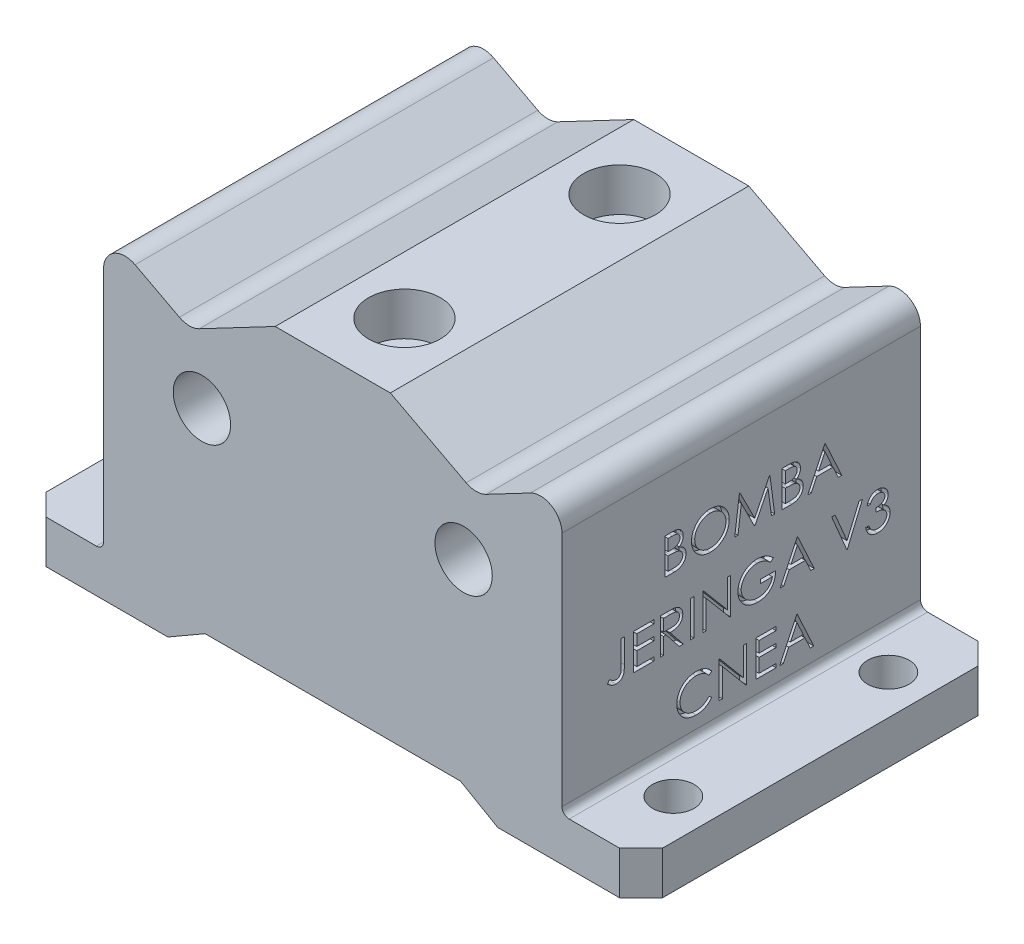
from build123d import *

# Parameters (mm, degrees)
SALIENTE_EXTRUIR1_DEPTH                              = 25
REDONDEO1_R                                          = 3
CHAFL_N1_SIZE                                        = 3
REDONDEO2_R                                          = 1
REDONDEO1_OF_SIMETR_A1_R                             = 3
CHAFL_N1_OF_SIMETR_A1_SIZE                           = 3
REDONDEO2_OF_SIMETR_A1_R                             = 1
TALADRO_DE_MARGEN_PARA_M51_D                         = 5.8
REFRENTADO_PARA_TORNILLO_CON_CABEZA_HUEC_D           = 4.8
REFRENTADO_PARA_TORNILLO_CON_CABEZA_HUEC_CBORE_D     = 8
REFRENTADO_PARA_TORNILLO_CON_CABEZA_HUEC_CBORE_DEPTH = 42
REFRENTADO_PARA_TORNILLO_CON_CABEZA_2_D              = 5.5
REFRENTADO_PARA_TORNILLO_CON_CABEZA_2_CBORE_D        = 10
REFRENTADO_PARA_TORNILLO_CON_CABEZA_2_CBORE_DEPTH    = 30
REFRENTADO_PARA_TORNILLO_CON_CABEZA_3_D              = 5.5
REFRENTADO_PARA_TORNILLO_CON_CABEZA_3_CBORE_D        = 10
REFRENTADO_PARA_TORNILLO_CON_CABEZA_3_CBORE_DEPTH    = 6
CROQUIS28_W                                          = 0.448717949
CROQUIS28_H                                          = 5
CORTAR_EXTRUIR1_DEPTH                                = 1
TALADRO1_D                                           = 4.1
TALADRO1_DEPTH                                       = 5


with BuildPart() as part:
    # Croquis2 → Saliente-Extruir1 (new, symmetric)
    with BuildSketch(Plane.XY):
        Polygon((-43, 6), (-43, 0), (-23, 0), (-17.803847577, 3), (0, 3), (0, 45), (-8.029229647, 45), (-20, 38.699473768), (-31.970770353, 45), (-31.970770353, 6), align=None)
    saliente_extruir1 = extrude(amount=SALIENTE_EXTRUIR1_DEPTH, both=True)

    # Croquis21 → Diámetro de taladro Ø8.6 (8.6)1 (revolve, cut)
    with BuildSketch(Plane(origin=(-22, 20, -25), x_dir=(0, 1, 0), z_dir=(1, 0, 0))):
        Polygon((0, 0), (0, 16.3), (4.3, 12), (4.3, 0), align=None)
    di_metro_de_taladro_8_6_8_6_1 = revolve(axis=Axis((-22, 20, -31.35), (0, 0, 1)), mode=Mode.SUBTRACT)

    # Redondeo1
    redondeo1_edges = [part.edges().sort_by_distance(p)[0] for p in [
        (-20, 38.699473768, 0),
        (-31.970770353, 45, 0),
    ]]
    fillet(redondeo1_edges, radius=REDONDEO1_R)

    # Chaflán1
    chafl_n1_edges = [part.edges().sort_by_distance(p)[0] for p in [
        (-43, 3, -25),
        (-43, 3, 25),
    ]]
    chamfer(chafl_n1_edges, length=CHAFL_N1_SIZE)

    # Redondeo2
    redondeo2_edges = [part.edges().sort_by_distance(p)[0] for p in [
        (-31.970770353, 6, 0),
    ]]
    fillet(redondeo2_edges, radius=REDONDEO2_R)

    # Simetría1: Saliente-Extruir1, Diámetro de taladro Ø8.6 (8.6)1 across plane
    add(saliente_extruir1.mirror(Plane(origin=(0, 0, 0), x_dir=(0, 0, 1), z_dir=(1, 0, 0))))
    add(di_metro_de_taladro_8_6_8_6_1.mirror(Plane(origin=(0, 0, 0), x_dir=(0, 0, 1), z_dir=(1, 0, 0))), mode=Mode.SUBTRACT)

    # Redondeo1 of Simetría1
    redondeo1_of_simetr_a1_edges = [part.edges().sort_by_distance(p)[0] for p in [
        (20, 38.699473768, 0),
        (31.970770353, 45, 0),
    ]]
    fillet(redondeo1_of_simetr_a1_edges, radius=REDONDEO1_OF_SIMETR_A1_R)

    # Chaflán1 of Simetría1
    chafl_n1_of_simetr_a1_edges = [part.edges().sort_by_distance(p)[0] for p in [
        (43, 3, -25),
        (43, 3, 25),
    ]]
    chamfer(chafl_n1_of_simetr_a1_edges, length=CHAFL_N1_OF_SIMETR_A1_SIZE)

    # Redondeo2 of Simetría1
    redondeo2_of_simetr_a1_edges = [part.edges().sort_by_distance(p)[0] for p in [
        (31.970770353, 6, 0),
    ]]
    fillet(redondeo2_of_simetr_a1_edges, radius=REDONDEO2_OF_SIMETR_A1_R)

    # Taladro de margen para M51 (through all)
    with Locations(Plane(origin=(0, 45, 0), x_dir=(-1, 0, 0), z_dir=(0, 1, 0))):
        with Locations((37.5, -15)):
            taladro_de_margen_para_m51 = Hole(TALADRO_DE_MARGEN_PARA_M51_D / 2)

    # Matriz de croquis1: Taladro de margen para M51 at 3 more places
    with Locations((75, 0, 30), (75, 0, 0), (0, 0, 30)):
        add(taladro_de_margen_para_m51, mode=Mode.SUBTRACT)

    # Refrentado para tornillo con cabeza huec (through all)
    with Locations(Plane(origin=(0, 0, 25), x_dir=(-1, 0, 0), z_dir=(0, 0, 1))):
        with Locations((-18.25, -30), (18.25, -30)):
            CounterBoreHole(REFRENTADO_PARA_TORNILLO_CON_CABEZA_HUEC_D / 2, REFRENTADO_PARA_TORNILLO_CON_CABEZA_HUEC_CBORE_D / 2, REFRENTADO_PARA_TORNILLO_CON_CABEZA_HUEC_CBORE_DEPTH)

    # Refrentado para tornillo con cabeza  2 (through all)
    with Locations(Plane(origin=(0, 3, 0), x_dir=(-1, 0, 0), z_dir=(0, -1, 0))):
        with Locations((0, 15), (0, -15)):
            CounterBoreHole(REFRENTADO_PARA_TORNILLO_CON_CABEZA_2_D / 2, REFRENTADO_PARA_TORNILLO_CON_CABEZA_2_CBORE_D / 2, REFRENTADO_PARA_TORNILLO_CON_CABEZA_2_CBORE_DEPTH)

    # Refrentado para tornillo con cabeza  3 (through all)
    with Locations(Plane(origin=(0, 45, 0), x_dir=(1, 0, 0), z_dir=(0, 1, 0))):
        with Locations((0, 15), (0, -15)):
            CounterBoreHole(REFRENTADO_PARA_TORNILLO_CON_CABEZA_3_D / 2, REFRENTADO_PARA_TORNILLO_CON_CABEZA_3_CBORE_D / 2, REFRENTADO_PARA_TORNILLO_CON_CABEZA_3_CBORE_DEPTH)

    # Croquis28 → Cortar-Extruir1 (cut)
    # profile 1 of 18: a face of its own
    with BuildSketch(Plane(origin=(31.970770353, 0, 0), x_dir=(0, 0, -1), z_dir=(1, 0, 0))):
        with BuildLine():
            Line((-10.649410219, 32.506300776), (-9.673849322, 32.506300776))
            add(Edge.make_bspline(
                [(-9.673849322, 32.506300776), (-9.626094353, 32.506049704), (-9.533533338, 32.505563064), (-9.398934135, 32.498015734), (-9.272864406, 32.487724777), (-9.155287588, 32.471396073), (-9.046258013, 32.451693534), (-8.945447103, 32.427833797), (-8.853175428, 32.399224349), (-8.743014376, 32.353729662), (-8.617413432, 32.286125135), (-8.481415728, 32.186227185), (-8.365123958, 32.064037952), (-8.26485779, 31.926205587), (-8.185141905, 31.774583056), (-8.12747148, 31.612784215), (-8.09096023, 31.442896012), (-8.087205324, 31.326262901), (-8.085307655, 31.267318404)],
                knots=[0, 0, 0, 0, 1.001505555, 1.941167018, 2.826882275, 3.653841531, 4.429895133, 5.150066043, 5.825578002, 6.45369114, 7.647487171, 8.808567382, 9.977351308, 11.170798116, 12.373658725, 13.556498008, 14.765093433, 16, 16, 16, 16], degree=3))
            add(Edge.make_bspline(
                [(-8.085307655, 31.267318404), (-8.086869395, 31.212100468), (-8.089938363, 31.103592015), (-8.119285162, 30.944886144), (-8.165228974, 30.793812975), (-8.229093616, 30.650923853), (-8.312096468, 30.519447262), (-8.410465494, 30.398322597), (-8.529146641, 30.292678229), (-8.618065555, 30.23361694), (-8.663232334, 30.203616481)],
                knots=[0, 0, 0, 0, 1.044552857, 2.05264487, 3.044412934, 4.028983338, 5.005914585, 5.980388656, 6.974128949, 8, 8, 8, 8], degree=3))
            add(Edge.make_bspline(
                [(-8.663232334, 30.203616481), (-8.606431723, 30.18180934), (-8.497758084, 30.140086876), (-8.348206638, 30.066321928), (-8.219356859, 29.986090342), (-8.110218079, 29.898473413), (-8.016878572, 29.804032255), (-7.93537437, 29.701382091), (-7.86582955, 29.589183866), (-7.806239659, 29.468607387), (-7.759741436, 29.340883861), (-7.724918716, 29.207211323), (-7.704965217, 29.068069102), (-7.702125729, 28.973375702), (-7.70069227, 28.925571609)],
                knots=[0, 0, 0, 0, 1.27268992, 2.434971085, 3.483601985, 4.442670788, 5.356604649, 6.2567628, 7.179492994, 8.113709626, 9.066344395, 10.018646069, 10.999752585, 12, 12, 12, 12], degree=3))
            add(Edge.make_bspline(
                [(-7.70069227, 28.925571609), (-7.702087765, 28.876761792), (-7.704833439, 28.780727109), (-7.725090541, 28.639648345), (-7.759389266, 28.504826993), (-7.80663376, 28.375391018), (-7.86829421, 28.251590826), (-7.943334159, 28.133286163), (-8.032807821, 28.021665691), (-8.132897634, 27.915489086), (-8.24612927, 27.820020819), (-8.368294635, 27.73499838), (-8.500932234, 27.665075435), (-8.641863654, 27.606338261), (-8.79266982, 27.561470835), (-8.952673545, 27.530081443), (-9.121736833, 27.50893139), (-9.237750764, 27.507192526), (-9.297246757, 27.506300776)],
                knots=[0, 0, 0, 0, 0.978564426, 1.925352924, 2.850884081, 3.763762016, 4.682927383, 5.618979971, 6.567305752, 7.547517671, 8.540179244, 9.531824382, 10.526200242, 11.540722885, 12.589160233, 13.674978461, 14.80764778, 16, 16, 16, 16], degree=3))
            Line((-9.297246757, 27.506300776), (-10.649410219, 27.506300776))
            Line((-10.649410219, 27.506300776), (-10.649410219, 32.506300776))
        make_face()
        with BuildLine():
            Line((-10.20069227, 31.993480263), (-10.20069227, 30.390916161))
            Line((-10.20069227, 30.390916161), (-9.899209898, 30.390916161))
            add(Edge.make_bspline(
                [(-9.899209898, 30.390916161), (-9.855140191, 30.391487479), (-9.769988535, 30.392591383), (-9.646674397, 30.39575355), (-9.532210085, 30.404607898), (-9.426793181, 30.413459701), (-9.330589689, 30.427851969), (-9.243812744, 30.444983573), (-9.165100463, 30.463102009), (-9.074329684, 30.493915562), (-8.971368329, 30.539455098), (-8.861606751, 30.61012915), (-8.764843223, 30.694306797), (-8.683132955, 30.791436742), (-8.616259426, 30.898388436), (-8.569811261, 31.013455408), (-8.538315141, 31.133769883), (-8.535470096, 31.216367387), (-8.534025604, 31.258303981)],
                knots=[0, 0, 0, 0, 1.156816544, 2.235205308, 3.236616184, 4.169592532, 5.011045266, 5.787822928, 6.49130361, 7.128639758, 8.301311294, 9.436451833, 10.541879658, 11.654887649, 12.756523258, 13.837046038, 14.901820046, 16, 16, 16, 16], degree=3))
            add(Edge.make_bspline(
                [(-8.534025604, 31.258303981), (-8.53477729, 31.286055083), (-8.536251804, 31.340491901), (-8.54832795, 31.419848121), (-8.568853057, 31.494482053), (-8.595216333, 31.565416496), (-8.632057317, 31.630433425), (-8.675433693, 31.691780848), (-8.727841822, 31.747369588), (-8.787495125, 31.799326015), (-8.856078872, 31.845389626), (-8.933552146, 31.885733573), (-9.020963114, 31.918220397), (-9.116838621, 31.946672043), (-9.22265446, 31.96665532), (-9.337189536, 31.983303017), (-9.461381992, 31.991778363), (-9.547303567, 31.99290031), (-9.591717911, 31.993480263)],
                knots=[0, 0, 0, 0, 0.91205012, 1.789085906, 2.630437955, 3.453916878, 4.269457761, 5.079663411, 5.91843418, 6.774407191, 7.675494373, 8.627863946, 9.638891023, 10.736472738, 11.911756761, 13.175263542, 14.539845004, 16, 16, 16, 16], degree=3))
            Line((-9.591717911, 31.993480263), (-10.20069227, 31.993480263))
        make_face(mode=Mode.SUBTRACT)
        with BuildLine():
            Line((-10.20069227, 29.878095648), (-10.20069227, 28.019121289))
            Line((-10.20069227, 28.019121289), (-9.561669834, 28.019121289))
            add(Edge.make_bspline(
                [(-9.561669834, 28.019121289), (-9.515928512, 28.0196695), (-9.427768142, 28.020726103), (-9.300480671, 28.024175467), (-9.182504808, 28.032021575), (-9.0743789, 28.044372789), (-8.974935396, 28.057770573), (-8.885367249, 28.075786689), (-8.804948401, 28.096428061), (-8.71169939, 28.128334021), (-8.606694378, 28.177900408), (-8.493536012, 28.252635018), (-8.392927129, 28.341668314), (-8.307491044, 28.444712477), (-8.237472489, 28.55675723), (-8.186536125, 28.675536302), (-8.155120615, 28.799087055), (-8.151317516, 28.883325216), (-8.149410219, 28.925571609)],
                knots=[0, 0, 0, 0, 1.160039823, 2.235823828, 3.228722157, 4.157150951, 4.99529583, 5.772374946, 6.472645482, 7.099169577, 8.269452708, 9.405989375, 10.527446681, 11.663510218, 12.788923519, 13.866172445, 14.929861265, 16, 16, 16, 16], degree=3))
            add(Edge.make_bspline(
                [(-8.149410219, 28.925571609), (-8.149804654, 28.951990667), (-8.150587161, 29.004402641), (-8.162388039, 29.08142524), (-8.179550711, 29.156033631), (-8.201738473, 29.228430403), (-8.234051998, 29.297306655), (-8.271775633, 29.364024597), (-8.316006207, 29.428672425), (-8.384926444, 29.510404215), (-8.485172136, 29.604571377), (-8.627610387, 29.696767808), (-8.789570813, 29.771121818), (-8.90703866, 29.802692499), (-8.967719514, 29.819001097)],
                knots=[0, 0, 0, 0, 0.723448775, 1.435228256, 2.130040452, 2.821711965, 3.505591119, 4.210454504, 4.921174351, 5.648778258, 7.137944449, 8.670945889, 10.280296675, 12, 12, 12, 12], degree=3))
            add(Edge.make_bspline(
                [(-8.967719514, 29.819001097), (-8.992046794, 29.823936931), (-9.044793354, 29.834638838), (-9.130804183, 29.845935557), (-9.228998282, 29.855999928), (-9.339602392, 29.863444439), (-9.462756451, 29.871139501), (-9.598723477, 29.874132103), (-9.746948213, 29.877702474), (-9.849794459, 29.877961237), (-9.903216309, 29.878095648)],
                knots=[0, 0, 0, 0, 0.634451884, 1.375622551, 2.216452059, 3.157844607, 4.20941857, 5.370758133, 6.634282058, 8, 8, 8, 8], degree=3))
            Line((-9.903216309, 29.878095648), (-10.20069227, 29.878095648))
        make_face(mode=Mode.SUBTRACT)
    # profile 2 of 18: a face of its own
    with BuildSketch(Plane(origin=(31.970770353, 0, 0), x_dir=(0, 0, -1), z_dir=(1, 0, 0))):
        with BuildLine():
            add(Edge.make_bspline(
                [(-4.335307655, 32.634505904), (-4.242724646, 32.632160934), (-4.060883979, 32.627555218), (-3.793634125, 32.592299356), (-3.538498275, 32.531305942), (-3.293398077, 32.45007311), (-3.061265253, 32.341709702), (-2.84035255, 32.210730919), (-2.631185587, 32.055764549), (-2.436583613, 31.878008511), (-2.258502256, 31.684603576), (-2.101608133, 31.478206562), (-1.970119141, 31.260065416), (-1.862139446, 31.030835658), (-1.777427146, 30.791035704), (-1.718971369, 30.539387128), (-1.681631155, 30.277520428), (-1.677265758, 30.098910621), (-1.675051245, 30.008303981)],
                knots=[0, 0, 0, 0, 1.065120563, 2.091984664, 3.0946048, 4.079830382, 5.057816894, 6.036188127, 7.030412546, 8.04752943, 9.064399622, 10.05169764, 11.02544977, 11.989514704, 12.962713494, 13.945757189, 14.957906945, 16, 16, 16, 16], degree=3))
            add(Edge.make_bspline(
                [(-1.675051245, 30.008303981), (-1.677265434, 29.918364772), (-1.681629858, 29.741084172), (-1.719013825, 29.480879251), (-1.777643825, 29.230749685), (-1.861352777, 28.991113038), (-1.968817746, 28.761716518), (-2.101182277, 28.543163727), (-2.257098292, 28.335383015), (-2.434536651, 28.140650636), (-2.627966711, 27.962082821), (-2.83543852, 27.806484427), (-3.05228612, 27.672592821), (-3.281299989, 27.565759001), (-3.519442899, 27.480370543), (-3.768846217, 27.4221525), (-4.028341295, 27.384599581), (-4.205299871, 27.380287415), (-4.295243552, 27.378095648)],
                knots=[0, 0, 0, 0, 1.043624062, 2.057103931, 3.04512605, 4.022047818, 4.998200453, 5.980619268, 6.982898556, 8.009068085, 9.034988726, 10.034168286, 11.015286542, 11.987931943, 12.962482838, 13.94673481, 14.956375938, 16, 16, 16, 16], degree=3))
            add(Edge.make_bspline(
                [(-4.295243552, 27.378095648), (-4.385849722, 27.380309058), (-4.564458602, 27.384672278), (-4.826654367, 27.422074284), (-5.078479715, 27.480561861), (-5.319214503, 27.56414677), (-5.548992974, 27.672171386), (-5.76826452, 27.803891927), (-5.976149016, 27.960187843), (-6.17092294, 28.137568664), (-6.34913608, 28.330670881), (-6.504506617, 28.53757696), (-6.636256779, 28.754227612), (-6.743918682, 28.981224075), (-6.829153624, 29.217468993), (-6.887303364, 29.464538247), (-6.924926153, 29.721023255), (-6.929261648, 29.895655967), (-6.931461501, 29.98426552)],
                knots=[0, 0, 0, 0, 1.053102029, 2.075944431, 3.073151272, 4.055350789, 5.033113405, 6.020478099, 7.024410459, 8.052272461, 9.079885166, 10.07527673, 11.055994387, 12.023226415, 12.992069828, 13.970394897, 14.97016774, 16, 16, 16, 16], degree=3))
            add(Edge.make_bspline(
                [(-6.931461501, 29.98426552), (-6.930697736, 30.043740761), (-6.929179841, 30.161940938), (-6.910905995, 30.337464652), (-6.884389279, 30.510165592), (-6.846386547, 30.67955266), (-6.796684165, 30.84521121), (-6.738038412, 31.008283728), (-6.666410061, 31.167117619), (-6.585437707, 31.322465322), (-6.495063695, 31.471905187), (-6.395241196, 31.613161735), (-6.289476384, 31.747420302), (-6.173528679, 31.871201736), (-6.051219472, 31.988106959), (-5.920564646, 32.096339412), (-5.782361439, 32.196875056), (-5.636015183, 32.287475543), (-5.485131933, 32.369417164), (-5.329593679, 32.439734094), (-5.171512862, 32.500085611), (-5.01014908, 32.549001075), (-4.845930834, 32.58761827), (-4.678499713, 32.613914489), (-4.507989104, 32.632234943), (-4.393115791, 32.63374566), (-4.335307655, 32.634505904)],
                knots=[0, 0, 0, 0, 1.037015668, 2.060948919, 3.074880161, 4.083647147, 5.086022904, 6.090072063, 7.104153813, 8.122640571, 9.144368836, 10.147691507, 11.138137339, 12.123020368, 13.103399296, 14.087645067, 15.080126199, 16.082011238, 17.087798457, 18.072939717, 19.057185487, 20.037253025, 21.01195951, 21.997135196, 22.992090687, 24, 24, 24, 24], degree=3))
        make_face()
        with BuildLine():
            add(Edge.make_bspline(
                [(-4.313272398, 32.121685392), (-4.360721875, 32.121106977), (-4.455167208, 32.119955677), (-4.595573688, 32.104790369), (-4.734133594, 32.083176242), (-4.870875539, 32.052345498), (-5.005227381, 32.010339709), (-5.13844144, 31.961995554), (-5.269302946, 31.903108282), (-5.397379886, 31.836575847), (-5.521544279, 31.762934531), (-5.638705281, 31.681546293), (-5.749166201, 31.594319787), (-5.852656582, 31.501051448), (-5.948872542, 31.401266302), (-6.03970783, 31.296477108), (-6.121521518, 31.183688692), (-6.196500913, 31.065959539), (-6.263597828, 30.943442995), (-6.32326262, 30.817428906), (-6.372068347, 30.686889353), (-6.411871742, 30.553240557), (-6.444871472, 30.416694186), (-6.465777078, 30.276214402), (-6.48110902, 30.132507099), (-6.482194513, 30.035390164), (-6.482743552, 29.986268725)],
                knots=[0, 0, 0, 0, 1.008559885, 2.007477868, 2.99961109, 3.989939068, 4.984837346, 5.991145699, 7.001802488, 8.033829008, 9.059044045, 10.069351652, 11.065060232, 12.050310815, 13.029377138, 14.011219647, 14.996725999, 15.989392538, 16.977580475, 17.965360261, 18.951710183, 19.937753436, 20.929683414, 21.935841486, 22.955955122, 24, 24, 24, 24], degree=3))
            add(Edge.make_bspline(
                [(-6.482743552, 29.986268725), (-6.480922321, 29.914036981), (-6.477339395, 29.771934795), (-6.445971438, 29.563694589), (-6.397654332, 29.363568466), (-6.326429523, 29.172651453), (-6.237357216, 28.989302477), (-6.127318801, 28.815148042), (-5.996948679, 28.650141078), (-5.848857927, 28.495433551), (-5.686968346, 28.35422526), (-5.515064446, 28.230277533), (-5.334987864, 28.125405747), (-5.146269003, 28.03996993), (-4.949915376, 27.972270304), (-4.744661731, 27.92587226), (-4.53187536, 27.895335895), (-4.386831567, 27.892403387), (-4.313272398, 27.890916161)],
                knots=[0, 0, 0, 0, 1.032063989, 2.030389145, 3.003944642, 3.970395727, 4.937377036, 5.913328081, 6.909231446, 7.93887556, 8.970685674, 9.976071282, 10.964166581, 11.944589148, 12.933237628, 13.927779006, 14.949070134, 16, 16, 16, 16], degree=3))
            add(Edge.make_bspline(
                [(-4.313272398, 27.890916161), (-4.263830253, 27.891595453), (-4.16577163, 27.892942693), (-4.019920884, 27.906512231), (-3.876697724, 27.928272044), (-3.736303039, 27.959601552), (-3.598896165, 27.998811847), (-3.463903589, 28.045394316), (-3.332763174, 28.103510321), (-3.203820549, 28.167721681), (-3.080397347, 28.240921906), (-2.962575158, 28.319547834), (-2.853323758, 28.406645863), (-2.749910799, 28.498528453), (-2.653299814, 28.597048235), (-2.564144123, 28.702077124), (-2.482743934, 28.814278062), (-2.40779301, 28.931828642), (-2.340931206, 29.054680432), (-2.28267535, 29.1811514), (-2.233252328, 29.310930128), (-2.193354464, 29.444203801), (-2.162089518, 29.5807193), (-2.140546776, 29.720659411), (-2.125477578, 29.863744186), (-2.124341753, 29.960521123), (-2.123769193, 30.009305584)],
                knots=[0, 0, 0, 0, 1.047197238, 2.076906641, 3.100256066, 4.114471768, 5.12198147, 6.126382909, 7.136867548, 8.15857795, 9.17633901, 10.174870724, 11.156907918, 12.133735059, 13.104061851, 14.077631395, 15.04955518, 16.038496417, 17.029181396, 18.010275684, 18.986308667, 19.968651475, 20.955262928, 21.950658345, 22.966943676, 24, 24, 24, 24], degree=3))
            add(Edge.make_bspline(
                [(-2.123769193, 30.009305584), (-2.124342212, 30.057756304), (-2.1254789, 30.153867233), (-2.140539578, 30.295954116), (-2.162112278, 30.434887276), (-2.193201861, 30.57012128), (-2.233273509, 30.701690601), (-2.282683981, 30.82947167), (-2.340948695, 30.95394052), (-2.407817587, 31.074789515), (-2.482983049, 31.190753427), (-2.565117682, 31.301614016), (-2.655639608, 31.405289361), (-2.751962501, 31.504338924), (-2.856492337, 31.596650195), (-2.968755614, 31.682253796), (-3.08738944, 31.763215616), (-3.212999776, 31.836252133), (-3.342633996, 31.903701037), (-3.475653936, 31.961488184), (-3.610552649, 32.010591212), (-3.746987095, 32.05247259), (-3.886105636, 32.083055491), (-4.026968249, 32.104809848), (-4.169380047, 32.119950399), (-4.265156075, 32.121105225), (-4.313272398, 32.121685392)],
                knots=[0, 0, 0, 0, 1.02996197, 2.043119294, 3.035359645, 4.018872909, 4.991431989, 5.957985074, 6.929999688, 7.912076566, 8.892894881, 9.867085534, 10.843653904, 11.817741046, 12.803660682, 13.806313499, 14.818574707, 15.856120519, 16.894564902, 17.924820532, 18.937903209, 19.946497019, 20.957711757, 21.963978472, 22.977135795, 24, 24, 24, 24], degree=3))
        make_face(mode=Mode.SUBTRACT)
    # profile 3 of 18: a face of its own
    with BuildSketch(Plane(origin=(31.970770353, 0, 0), x_dir=(0, 0, -1), z_dir=(1, 0, 0))):
        Polygon((-0.905820475, 27.506300776), (-0.245764386, 32.506300776), (-0.181661822, 32.506300776), (1.882641063, 28.403736674), (3.941935935, 32.506300776), (4.007040102, 32.506300776), (4.671102602, 27.506300776), (4.220381448, 27.506300776), (3.741615422, 31.104057186), (1.936727602, 27.506300776), (1.835565743, 27.506300776), (0.023666704, 31.112070007), (-0.454097719, 27.506300776), align=None)
    # profile 4 of 18: a face of its own
    with BuildSketch(Plane(origin=(31.970770353, 0, 0), x_dir=(0, 0, -1), z_dir=(1, 0, 0))):
        with BuildLine():
            Line((5.696743627, 32.506300776), (6.672304525, 32.506300776))
            add(Edge.make_bspline(
                [(6.672304525, 32.506300776), (6.720059493, 32.506049704), (6.812620508, 32.505563064), (6.947219711, 32.498015734), (7.07328944, 32.487724777), (7.190866258, 32.471396073), (7.299895833, 32.451693534), (7.400706743, 32.427833797), (7.492978418, 32.399224349), (7.60313947, 32.353729662), (7.728740414, 32.286125135), (7.864738118, 32.186227185), (7.981029888, 32.064037952), (8.081296056, 31.926205587), (8.161011941, 31.774583056), (8.218682366, 31.612784215), (8.255193616, 31.442896012), (8.258948522, 31.326262901), (8.260846191, 31.267318404)],
                knots=[0, 0, 0, 0, 1.001505555, 1.941167018, 2.826882275, 3.653841531, 4.429895133, 5.150066043, 5.825578002, 6.45369114, 7.647487171, 8.808567382, 9.977351308, 11.170798116, 12.373658725, 13.556498008, 14.765093433, 16, 16, 16, 16], degree=3))
            add(Edge.make_bspline(
                [(8.260846191, 31.267318404), (8.259284451, 31.212100468), (8.256215483, 31.103592015), (8.226868684, 30.944886144), (8.180924872, 30.793812975), (8.11706023, 30.650923853), (8.034057379, 30.519447262), (7.935688352, 30.398322597), (7.817007205, 30.292678229), (7.728088291, 30.23361694), (7.682921512, 30.203616481)],
                knots=[0, 0, 0, 0, 1.044552857, 2.05264487, 3.044412934, 4.028983338, 5.005914585, 5.980388656, 6.974128949, 8, 8, 8, 8], degree=3))
            add(Edge.make_bspline(
                [(7.682921512, 30.203616481), (7.739722123, 30.18180934), (7.848395762, 30.140086876), (7.997947208, 30.066321928), (8.126796987, 29.986090342), (8.235935767, 29.898473413), (8.329275274, 29.804032255), (8.410779476, 29.701382091), (8.480324296, 29.589183866), (8.539914187, 29.468607387), (8.58641241, 29.340883861), (8.62123513, 29.207211323), (8.641188629, 29.068069102), (8.644028117, 28.973375702), (8.645461576, 28.925571609)],
                knots=[0, 0, 0, 0, 1.27268992, 2.434971085, 3.483601985, 4.442670788, 5.356604649, 6.2567628, 7.179492994, 8.113709626, 9.066344395, 10.018646069, 10.999752585, 12, 12, 12, 12], degree=3))
            add(Edge.make_bspline(
                [(8.645461576, 28.925571609), (8.644066082, 28.876761792), (8.641320407, 28.780727109), (8.621063305, 28.639648345), (8.586764581, 28.504826993), (8.539520086, 28.375391018), (8.477859636, 28.251590826), (8.402819687, 28.133286163), (8.313346025, 28.021665691), (8.213256212, 27.915489086), (8.100024576, 27.820020819), (7.977859212, 27.73499838), (7.845221612, 27.665075435), (7.704290192, 27.606338261), (7.553484026, 27.561470835), (7.393480301, 27.530081443), (7.224417013, 27.50893139), (7.108403083, 27.507192526), (7.048907089, 27.506300776)],
                knots=[0, 0, 0, 0, 0.978564426, 1.925352924, 2.850884081, 3.763762016, 4.682927383, 5.618979971, 6.567305752, 7.547517671, 8.540179244, 9.531824382, 10.526200242, 11.540722885, 12.589160233, 13.674978461, 14.80764778, 16, 16, 16, 16], degree=3))
            Line((7.048907089, 27.506300776), (5.696743627, 27.506300776))
            Line((5.696743627, 27.506300776), (5.696743627, 32.506300776))
        make_face()
        with BuildLine():
            Line((6.145461576, 31.993480263), (6.145461576, 30.390916161))
            Line((6.145461576, 30.390916161), (6.446943948, 30.390916161))
            add(Edge.make_bspline(
                [(6.446943948, 30.390916161), (6.491013655, 30.391487479), (6.576165311, 30.392591383), (6.699479449, 30.39575355), (6.813943761, 30.404607898), (6.919360665, 30.413459701), (7.015564157, 30.427851969), (7.102341102, 30.444983573), (7.181053383, 30.463102009), (7.271824163, 30.493915562), (7.374785518, 30.539455098), (7.484547095, 30.61012915), (7.581310623, 30.694306797), (7.663020891, 30.791436742), (7.72989442, 30.898388436), (7.776342585, 31.013455408), (7.807838705, 31.133769883), (7.81068375, 31.216367387), (7.812128243, 31.258303981)],
                knots=[0, 0, 0, 0, 1.156816544, 2.235205308, 3.236616184, 4.169592532, 5.011045266, 5.787822928, 6.49130361, 7.128639758, 8.301311294, 9.436451833, 10.541879658, 11.654887649, 12.756523258, 13.837046038, 14.901820046, 16, 16, 16, 16], degree=3))
            add(Edge.make_bspline(
                [(7.812128243, 31.258303981), (7.811376557, 31.286055083), (7.809902042, 31.340491901), (7.797825896, 31.419848121), (7.77730079, 31.494482053), (7.750937514, 31.565416496), (7.71409653, 31.630433425), (7.670720153, 31.691780848), (7.618312025, 31.747369588), (7.558658721, 31.799326015), (7.490074974, 31.845389626), (7.4126017, 31.885733573), (7.325190732, 31.918220397), (7.229315225, 31.946672043), (7.123499386, 31.96665532), (7.00896431, 31.983303017), (6.884771854, 31.991778363), (6.798850279, 31.99290031), (6.754435935, 31.993480263)],
                knots=[0, 0, 0, 0, 0.91205012, 1.789085906, 2.630437955, 3.453916878, 4.269457761, 5.079663411, 5.91843418, 6.774407191, 7.675494373, 8.627863946, 9.638891023, 10.736472738, 11.911756761, 13.175263542, 14.539845004, 16, 16, 16, 16], degree=3))
            Line((6.754435935, 31.993480263), (6.145461576, 31.993480263))
        make_face(mode=Mode.SUBTRACT)
        with BuildLine():
            Line((6.145461576, 29.878095648), (6.145461576, 28.019121289))
            Line((6.145461576, 28.019121289), (6.784484012, 28.019121289))
            add(Edge.make_bspline(
                [(6.784484012, 28.019121289), (6.830225335, 28.0196695), (6.918385704, 28.020726103), (7.045673176, 28.024175467), (7.163649038, 28.032021575), (7.271774946, 28.044372789), (7.37121845, 28.057770573), (7.460786597, 28.075786689), (7.541205445, 28.096428061), (7.634454456, 28.128334021), (7.739459468, 28.177900408), (7.852617834, 28.252635018), (7.953226717, 28.341668314), (8.038662802, 28.444712477), (8.108681357, 28.55675723), (8.159617721, 28.675536302), (8.191033231, 28.799087055), (8.19483633, 28.883325216), (8.196743627, 28.925571609)],
                knots=[0, 0, 0, 0, 1.160039823, 2.235823828, 3.228722157, 4.157150951, 4.99529583, 5.772374946, 6.472645482, 7.099169577, 8.269452708, 9.405989375, 10.527446681, 11.663510218, 12.788923519, 13.866172445, 14.929861265, 16, 16, 16, 16], degree=3))
            add(Edge.make_bspline(
                [(8.196743627, 28.925571609), (8.196349192, 28.951990667), (8.195566685, 29.004402641), (8.183765807, 29.08142524), (8.166603136, 29.156033631), (8.144415373, 29.228430403), (8.112101848, 29.297306655), (8.074378213, 29.364024597), (8.030147639, 29.428672425), (7.961227402, 29.510404215), (7.86098171, 29.604571377), (7.718543459, 29.696767808), (7.556583034, 29.771121818), (7.439115187, 29.802692499), (7.378434332, 29.819001097)],
                knots=[0, 0, 0, 0, 0.723448775, 1.435228256, 2.130040452, 2.821711965, 3.505591119, 4.210454504, 4.921174351, 5.648778258, 7.137944449, 8.670945889, 10.280296675, 12, 12, 12, 12], degree=3))
            add(Edge.make_bspline(
                [(7.378434332, 29.819001097), (7.354107053, 29.823936931), (7.301360492, 29.834638838), (7.215349663, 29.845935557), (7.117155564, 29.855999928), (7.006551454, 29.863444439), (6.883397395, 29.871139501), (6.747430369, 29.874132103), (6.599205633, 29.877702474), (6.496359387, 29.877961237), (6.442937537, 29.878095648)],
                knots=[0, 0, 0, 0, 0.634451884, 1.375622551, 2.216452059, 3.157844607, 4.20941857, 5.370758133, 6.634282058, 8, 8, 8, 8], degree=3))
            Line((6.442937537, 29.878095648), (6.145461576, 29.878095648))
        make_face(mode=Mode.SUBTRACT)
    # profile 5 of 18: a face of its own
    with BuildSketch(Plane(origin=(31.970770353, 0, 0), x_dir=(0, 0, -1), z_dir=(1, 0, 0))):
        Polygon((11.722384653, 32.506300776), (14.030076961, 27.506300776), (13.542296512, 27.506300776), (12.80311382, 29.108864879), (10.536487217, 29.108864879), (9.776270871, 27.506300776), (9.286487217, 27.506300776), (11.658282089, 32.506300776), align=None)
        Polygon((11.685325358, 31.531741481), (10.77987664, 29.621685392), (12.566735614, 29.621685392), align=None, mode=Mode.SUBTRACT)
    # profile 6 of 18: a face of its own
    with BuildSketch(Plane(origin=(31.970770353, 0, 0), x_dir=(0, 0, -1), z_dir=(1, 0, 0))):
        with BuildLine():
            Line((-16.739153809, 23.172967443), (-16.29043586, 23.172967443))
            Line((-16.29043586, 23.172967443), (-16.29043586, 19.796565199))
            add(Edge.make_bspline(
                [(-16.29043586, 19.796565199), (-16.290884315, 19.734129241), (-16.291745404, 19.614244582), (-16.296480276, 19.441567588), (-16.305242387, 19.283895179), (-16.318006691, 19.140868826), (-16.335035595, 19.012936604), (-16.354522778, 18.899110007), (-16.37811249, 18.800339033), (-16.413636014, 18.689431382), (-16.471884512, 18.567797375), (-16.559551709, 18.436432874), (-16.668455704, 18.321528002), (-16.794600037, 18.221738395), (-16.939087214, 18.142228064), (-17.098941813, 18.085149238), (-17.273179795, 18.050333729), (-17.394035813, 18.046656721), (-17.456301245, 18.044762315)],
                knots=[0, 0, 0, 0, 1.237770943, 2.376671248, 3.424123796, 4.367912054, 5.222547132, 5.982086412, 6.656319012, 7.234008312, 8.288027371, 9.317870876, 10.352700517, 11.413286737, 12.494591526, 13.606319346, 14.766767577, 16, 16, 16, 16], degree=3))
            add(Edge.make_bspline(
                [(-17.456301245, 18.044762315), (-17.504813185, 18.046306042), (-17.602422422, 18.049412124), (-17.747694863, 18.074728856), (-17.892554829, 18.113751776), (-18.037771184, 18.17089834), (-18.186212958, 18.248620624), (-18.339890596, 18.350313219), (-18.500780868, 18.475786828), (-18.606756991, 18.571555036), (-18.662230732, 18.621685392)],
                knots=[0, 0, 0, 0, 0.848567217, 1.707373443, 2.573483905, 3.470863513, 4.432650262, 5.500696352, 6.691726801, 8, 8, 8, 8], degree=3))
            Line((-18.662230732, 18.621685392), (-18.397807655, 19.006300776))
            add(Edge.make_bspline(
                [(-18.397807655, 19.006300776), (-18.336803828, 18.964233067), (-18.221620648, 18.884803748), (-18.052328589, 18.78262289), (-17.902332656, 18.695015511), (-17.80421416, 18.650369398), (-17.758785219, 18.629698212)],
                knots=[0, 0, 0, 0, 1.196737151, 2.259595785, 3.194191475, 4, 4, 4, 4], degree=3))
            add(Edge.make_bspline(
                [(-17.758785219, 18.629698212), (-17.731236202, 18.618898987), (-17.677206446, 18.597719303), (-17.59459919, 18.574082305), (-17.512463423, 18.561164577), (-17.458009574, 18.558762672), (-17.43126118, 18.557582827)],
                knots=[0, 0, 0, 0, 1.051806502, 2.062826769, 3.048436908, 4, 4, 4, 4], degree=3))
            add(Edge.make_bspline(
                [(-17.43126118, 18.557582827), (-17.39671434, 18.559043877), (-17.328427974, 18.561931834), (-17.229193697, 18.587430799), (-17.134253652, 18.626351375), (-17.047011284, 18.683338937), (-16.966603588, 18.75109811), (-16.900256694, 18.833035265), (-16.844946345, 18.923843813), (-16.811661069, 19.009803033), (-16.790454252, 19.088198219), (-16.776994785, 19.160245556), (-16.76522527, 19.24447624), (-16.75496591, 19.340990812), (-16.748959524, 19.4499825), (-16.742220562, 19.571131276), (-16.739784475, 19.704742579), (-16.739370446, 19.797901082), (-16.739153809, 19.846645327)],
                knots=[0, 0, 0, 0, 0.997221856, 1.971139923, 2.944579524, 3.951425367, 4.971190333, 5.972282193, 6.985401279, 8.033996657, 8.624075553, 9.332086008, 10.151144245, 11.082816738, 12.137127781, 13.306538797, 14.590673636, 16, 16, 16, 16], degree=3))
            Line((-16.739153809, 19.846645327), (-16.739153809, 23.172967443))
        make_face()
    # profile 7 of 18: a face of its own
    with BuildSketch(Plane(origin=(31.970770353, 0, 0), x_dir=(0, 0, -1), z_dir=(1, 0, 0))):
        Polygon((-15.008384578, 23.172967443), (-12.187871757, 23.172967443), (-12.187871757, 22.66014693), (-14.559666629, 22.66014693), (-14.559666629, 21.121685392), (-12.187871757, 21.121685392), (-12.187871757, 20.608864879), (-14.559666629, 20.608864879), (-14.559666629, 18.685787956), (-12.187871757, 18.685787956), (-12.187871757, 18.172967443), (-15.008384578, 18.172967443), align=None)
    # profile 8 of 18: a face of its own
    with BuildSketch(Plane(origin=(31.970770353, 0, 0), x_dir=(0, 0, -1), z_dir=(1, 0, 0))):
        with BuildLine():
            Line((-11.29043586, 23.172967443), (-10.289834898, 23.172967443))
            add(Edge.make_bspline(
                [(-10.289834898, 23.172967443), (-10.223061858, 23.172745177), (-10.094850223, 23.172318402), (-9.911174122, 23.169938741), (-9.744278269, 23.163118233), (-9.594249928, 23.157248828), (-9.461091849, 23.146546055), (-9.344395719, 23.136316559), (-9.244699009, 23.122925615), (-9.184347793, 23.110489296), (-9.157022398, 23.104858468)],
                knots=[0, 0, 0, 0, 1.410062039, 2.707475311, 3.878576406, 4.937260626, 5.877586885, 6.699081471, 7.410979367, 8, 8, 8, 8], degree=3))
            add(Edge.make_bspline(
                [(-9.157022398, 23.104858468), (-9.120441507, 23.095820232), (-9.048060093, 23.07793657), (-8.943845713, 23.04013714), (-8.844539536, 22.996394819), (-8.750554073, 22.945018076), (-8.662360085, 22.885625533), (-8.579048213, 22.819242501), (-8.500240408, 22.746232207), (-8.429123793, 22.664753862), (-8.362068005, 22.579273134), (-8.305512825, 22.486839196), (-8.256760711, 22.390179871), (-8.217945686, 22.288312131), (-8.186691439, 22.182223886), (-8.164653954, 22.070954176), (-8.151437971, 21.955009926), (-8.150092464, 21.875927199), (-8.149410219, 21.83582802)],
                knots=[0, 0, 0, 0, 1.027469482, 2.033020251, 3.019912614, 3.986113645, 4.951240523, 5.91722682, 6.890402269, 7.87763091, 8.8651537, 9.85103654, 10.82876324, 11.815024772, 12.821070561, 13.842952187, 14.906261191, 16, 16, 16, 16], degree=3))
            add(Edge.make_bspline(
                [(-8.149410219, 21.83582802), (-8.151508788, 21.769206442), (-8.155603639, 21.639210488), (-8.193782358, 21.450552086), (-8.256320244, 21.27456735), (-8.342496371, 21.111477868), (-8.452238479, 20.96446266), (-8.584131038, 20.835333438), (-8.738247626, 20.72727642), (-8.881718077, 20.652343842), (-9.008452648, 20.604353972), (-9.112785952, 20.570587746), (-9.22659592, 20.544499224), (-9.348792112, 20.521127607), (-9.479883048, 20.503482329), (-9.619554533, 20.490558623), (-9.767906178, 20.48248141), (-9.869819135, 20.481278546), (-9.922246757, 20.48065975)],
                knots=[0, 0, 0, 0, 1.260483769, 2.459530307, 3.627416485, 4.787058657, 5.939039949, 7.08810263, 8.267026773, 9.491475466, 10.141966685, 10.831826277, 11.566392101, 12.351337768, 13.187381173, 14.07005841, 15.007169909, 16, 16, 16, 16], degree=3))
            Line((-9.922246757, 20.48065975), (-8.085307655, 18.172967443))
            Line((-8.085307655, 18.172967443), (-8.640195475, 18.172967443))
            Line((-8.640195475, 18.172967443), (-10.477134578, 20.48065975))
            Line((-10.477134578, 20.48065975), (-10.841717911, 20.48065975))
            Line((-10.841717911, 20.48065975), (-10.841717911, 18.172967443))
            Line((-10.841717911, 18.172967443), (-11.29043586, 18.172967443))
            Line((-11.29043586, 18.172967443), (-11.29043586, 23.172967443))
        make_face()
        with BuildLine():
            Line((-10.841717911, 22.66014693), (-10.841717911, 20.993480263))
            Line((-10.841717911, 20.993480263), (-9.926253168, 20.986469045))
            add(Edge.make_bspline(
                [(-9.926253168, 20.986469045), (-9.883510255, 20.986450136), (-9.800662316, 20.986413484), (-9.680804224, 20.992118878), (-9.569204064, 20.998609333), (-9.466288704, 21.00853697), (-9.372012168, 21.021331358), (-9.286421577, 21.037335621), (-9.209377217, 21.055981425), (-9.119522163, 21.08484089), (-9.019184261, 21.130563773), (-8.910139318, 21.197085914), (-8.817278835, 21.280756085), (-8.738824746, 21.37643245), (-8.675782701, 21.481627092), (-8.63133691, 21.595079048), (-8.603133421, 21.713924188), (-8.599806927, 21.795607199), (-8.598128168, 21.836829622)],
                knots=[0, 0, 0, 0, 1.146690395, 2.22261258, 3.21895312, 4.145990853, 4.996080663, 5.770904154, 6.481378293, 7.121626537, 8.300444488, 9.431385265, 10.535395872, 11.636531494, 12.74115979, 13.810798291, 14.895190096, 16, 16, 16, 16], degree=3))
            add(Edge.make_bspline(
                [(-8.598128168, 21.836829622), (-8.599845484, 21.877039013), (-8.603248577, 21.956719354), (-8.631032532, 22.073370655), (-8.678017362, 22.183466298), (-8.741334845, 22.286558419), (-8.818476495, 22.380138042), (-8.908930513, 22.460205403), (-9.010223649, 22.526276067), (-9.10489679, 22.568496611), (-9.189517093, 22.594382115), (-9.262988036, 22.612598064), (-9.346004433, 22.627233019), (-9.438969374, 22.638958821), (-9.541485989, 22.649037312), (-9.654072634, 22.655825568), (-9.77598232, 22.659845373), (-9.860477936, 22.660044072), (-9.904217911, 22.66014693)],
                knots=[0, 0, 0, 0, 1.101028733, 2.181837193, 3.264309656, 4.369019818, 5.486613113, 6.575447106, 7.666700264, 8.788928104, 9.402425223, 10.0903467, 10.862060571, 11.710948788, 12.657782767, 13.684531032, 14.801375019, 16, 16, 16, 16], degree=3))
            Line((-9.904217911, 22.66014693), (-10.841717911, 22.66014693))
        make_face(mode=Mode.SUBTRACT)
    # profile 9 of 18: a face of its own
    with BuildSketch(Plane(origin=(31.970770353, 0, 0), x_dir=(0, 0, -1), z_dir=(1, 0, 0))):
        with Locations((-6.835307655, 20.672967443)):
            Rectangle(CROQUIS28_W, CROQUIS28_H)
    # profile 10 of 18: a face of its own
    with BuildSketch(Plane(origin=(31.970770353, 0, 0), x_dir=(0, 0, -1), z_dir=(1, 0, 0))):
        Polygon((-5.328897398, 18.172967443), (-5.328897398, 23.172967443), (-5.234746757, 23.172967443), (-1.931461501, 19.237670968), (-1.931461501, 23.172967443), (-1.482743552, 23.172967443), (-1.482743552, 18.172967443), (-1.584907014, 18.172967443), (-4.88017945, 22.099249494), (-4.88017945, 18.172967443), align=None)
    # profile 11 of 18: a face of its own
    with BuildSketch(Plane(origin=(31.970770353, 0, 0), x_dir=(0, 0, -1), z_dir=(1, 0, 0))):
        with BuildLine():
            Line((4.478794909, 22.319602058), (4.094179525, 21.955018725))
            add(Edge.make_bspline(
                [(4.094179525, 21.955018725), (4.024581113, 22.020491386), (3.887043904, 22.149875476), (3.662814986, 22.317748326), (3.428866937, 22.461557041), (3.186420513, 22.57856595), (2.941479722, 22.671927037), (2.697295756, 22.738395808), (2.456373325, 22.780785147), (2.296134442, 22.785854247), (2.21717632, 22.788352058)],
                knots=[0, 0, 0, 0, 1.08915593, 2.152340314, 3.188132944, 4.216796309, 5.218260357, 6.173443236, 7.099959455, 8, 8, 8, 8], degree=3))
            add(Edge.make_bspline(
                [(2.21717632, 22.788352058), (2.168726748, 22.787761193), (2.071953262, 22.786580994), (1.928207627, 22.771517829), (1.785969574, 22.749853738), (1.64550761, 22.718508198), (1.50654863, 22.67878097), (1.369575927, 22.629087451), (1.234333991, 22.571151388), (1.102096733, 22.504204997), (0.973896013, 22.430662359), (0.85281482, 22.349164444), (0.738081393, 22.262323316), (0.631852214, 22.167964774), (0.533516233, 22.066943538), (0.440732844, 21.961138815), (0.356765279, 21.847659931), (0.280920757, 21.728594751), (0.213261302, 21.60603448), (0.153534655, 21.481158781), (0.103395957, 21.354381846), (0.063725307, 21.225544592), (0.030995801, 21.09564375), (0.007970648, 20.963779863), (-0.005010384, 20.829811741), (-0.007255784, 20.740101372), (-0.008384578, 20.695002699)],
                knots=[0, 0, 0, 0, 1.02818874, 2.053710826, 3.065248034, 4.081641283, 5.106893873, 6.131558223, 7.173050175, 8.228653731, 9.27666206, 10.308777013, 11.325269123, 12.329503258, 13.32196095, 14.316845687, 15.314881793, 16.315733098, 17.311955233, 18.285320748, 19.252783886, 20.203351036, 21.145449891, 22.095197417, 23.042428769, 24, 24, 24, 24], degree=3))
            add(Edge.make_bspline(
                [(-0.008384578, 20.695002699), (-0.00730498, 20.648901532), (-0.005148733, 20.556825084), (0.008651723, 20.41940498), (0.034263495, 20.284025834), (0.068503079, 20.150242787), (0.111332816, 20.017826718), (0.164722339, 19.887351704), (0.227958911, 19.758822574), (0.301153985, 19.633397407), (0.38141999, 19.511221659), (0.471338678, 19.396136628), (0.566853797, 19.286609803), (0.671445082, 19.185072998), (0.781758714, 19.088810289), (0.901090537, 19.000473829), (1.027094052, 18.918362081), (1.159961497, 18.843509911), (1.298251187, 18.776640574), (1.440046548, 18.717177865), (1.58580057, 18.668207384), (1.73474727, 18.628295806), (1.886709087, 18.595581096), (2.042457376, 18.574534696), (2.20084696, 18.55926208), (2.307616434, 18.558145409), (2.361407089, 18.557582827)],
                knots=[0, 0, 0, 0, 0.93586088, 1.869166235, 2.799637598, 3.729985548, 4.670839027, 5.622275134, 6.589130586, 7.576015415, 8.568469353, 9.55398029, 10.53834874, 11.515998671, 12.510579167, 13.508179873, 14.527009472, 15.561807829, 16.601455013, 17.643573243, 18.680854198, 19.719860599, 20.772568776, 21.833555941, 22.908541556, 24, 24, 24, 24], degree=3))
            add(Edge.make_bspline(
                [(2.361407089, 18.557582827), (2.426233299, 18.558937936), (2.553530095, 18.561598913), (2.740653585, 18.582313612), (2.920372257, 18.614666175), (3.092181119, 18.662046027), (3.25627972, 18.722479848), (3.413269636, 18.795330401), (3.561914863, 18.883391914), (3.702662254, 18.982783152), (3.832315376, 19.093518627), (3.949249839, 19.213010706), (4.051600538, 19.340679373), (4.140892965, 19.47577268), (4.214762471, 19.61940883), (4.275395036, 19.770883919), (4.321871167, 19.930266079), (4.340949702, 20.040396982), (4.350589781, 20.096044366)],
                knots=[0, 0, 0, 0, 1.13008108, 2.219097802, 3.278683437, 4.311054135, 5.322181354, 6.324827112, 7.324222904, 8.330512327, 9.32562643, 10.293043162, 11.24128371, 12.174520618, 13.111833804, 14.052305215, 15.015860969, 16, 16, 16, 16], degree=3))
            Line((4.350589781, 20.096044366), (2.683923114, 20.096044366))
            Line((2.683923114, 20.096044366), (2.683923114, 20.608864879))
            Line((2.683923114, 20.608864879), (4.79930773, 20.608864879))
            add(Edge.make_bspline(
                [(4.79930773, 20.608864879), (4.796870804, 20.513282752), (4.792101299, 20.326211264), (4.758645705, 20.053396591), (4.704622116, 19.795722743), (4.63082167, 19.552918355), (4.535285556, 19.325327508), (4.419039086, 19.112719128), (4.280221771, 18.916466727), (4.123778283, 18.73496815), (3.948206914, 18.573069276), (3.758251743, 18.430775079), (3.553598931, 18.3109142), (3.334442063, 18.213398968), (3.101498587, 18.137293261), (2.854229473, 18.083333865), (2.592970043, 18.051005346), (2.413917648, 18.046874804), (2.322344589, 18.044762315)],
                knots=[0, 0, 0, 0, 1.140356446, 2.231883559, 3.274166699, 4.278491846, 5.25512956, 6.21435461, 7.1637429, 8.11826594, 9.068280886, 10.0076534, 10.945064095, 11.891975133, 12.864533718, 13.863980011, 14.907571808, 16, 16, 16, 16], degree=3))
            add(Edge.make_bspline(
                [(2.322344589, 18.044762315), (2.265901538, 18.045575345), (2.154577651, 18.047178903), (1.99016204, 18.058575113), (1.830279725, 18.076118794), (1.674953998, 18.102611827), (1.523613509, 18.135061333), (1.377014102, 18.176613789), (1.234597327, 18.224711931), (1.096143062, 18.279420036), (0.962907995, 18.342808117), (0.834298685, 18.413250459), (0.70960422, 18.490383831), (0.589673984, 18.575542182), (0.473883097, 18.668088554), (0.362978177, 18.768208438), (0.256338351, 18.875595752), (0.189537689, 18.95185148), (0.155878243, 18.990275135)],
                knots=[0, 0, 0, 0, 1.107784379, 2.184907829, 3.233506516, 4.263428166, 5.276301166, 6.270063455, 7.25232949, 8.225834625, 9.190232166, 10.146266622, 11.1027726, 12.066435141, 13.031522626, 14.010570082, 14.99756817, 16, 16, 16, 16], degree=3))
            add(Edge.make_bspline(
                [(0.155878243, 18.990275135), (0.107041197, 19.051233211), (0.01017775, 19.172137521), (-0.114505331, 19.365851727), (-0.220793049, 19.566425813), (-0.307032795, 19.77441814), (-0.374372918, 19.989634158), (-0.422667565, 20.21179886), (-0.450963692, 20.441198332), (-0.455040174, 20.596434424), (-0.457102527, 20.674970648)],
                knots=[0, 0, 0, 0, 1.023165419, 2.029347347, 3.013907458, 3.994755782, 4.975994455, 5.96558838, 6.970761222, 8, 8, 8, 8], degree=3))
            add(Edge.make_bspline(
                [(-0.457102527, 20.674970648), (-0.456342186, 20.73377958), (-0.45483117, 20.85065002), (-0.436509004, 21.024160459), (-0.410221264, 21.194590019), (-0.371582614, 21.361799385), (-0.322873665, 21.52590023), (-0.26208297, 21.68696875), (-0.191304547, 21.845099995), (-0.109039553, 21.999205521), (-0.017490325, 22.147240397), (0.081867132, 22.288608687), (0.190443704, 22.420735923), (0.306466275, 22.54529542), (0.431319118, 22.660722345), (0.563832581, 22.76808536), (0.704108785, 22.867528482), (0.852589042, 22.957485389), (1.007057162, 23.038290561), (1.167142879, 23.109132292), (1.332797323, 23.167679886), (1.502779434, 23.217356714), (1.678375863, 23.254092629), (1.858312345, 23.280733694), (2.04352679, 23.298963122), (2.168721118, 23.300429202), (2.232200358, 23.301172571)],
                knots=[0, 0, 0, 0, 1.008945113, 2.00506715, 2.99143336, 3.967273523, 4.948097931, 5.927297278, 6.919902385, 7.919676788, 8.923139349, 9.905703106, 10.883022732, 11.856032218, 12.825136022, 13.798837087, 14.781400844, 15.773989409, 16.776158564, 17.77167057, 18.775803737, 19.789618931, 20.80898985, 21.851988756, 22.910860228, 24, 24, 24, 24], degree=3))
            add(Edge.make_bspline(
                [(2.232200358, 23.301172571), (2.283969277, 23.300344726), (2.386620961, 23.298703206), (2.539372008, 23.287325137), (2.689762028, 23.269291021), (2.838014014, 23.244681326), (2.983623109, 23.211161768), (3.127004116, 23.171049933), (3.268364882, 23.124347329), (3.407262381, 23.068648977), (3.544630547, 23.005429513), (3.681233176, 22.934267481), (3.816603528, 22.853946046), (3.950976358, 22.764226709), (4.085199012, 22.666650398), (4.217148502, 22.558426364), (4.35000985, 22.443822427), (4.435441014, 22.361419308), (4.478794909, 22.319602058)],
                knots=[0, 0, 0, 0, 0.985871117, 1.954866573, 2.915460327, 3.869826059, 4.81536089, 5.759505086, 6.70452669, 7.649098992, 8.607881297, 9.583363685, 10.581137262, 11.603961102, 12.659522466, 13.73993555, 14.853081303, 16, 16, 16, 16], degree=3))
        make_face()
    # profile 12 of 18: a face of its own
    with BuildSketch(Plane(origin=(31.970770353, 0, 0), x_dir=(0, 0, -1), z_dir=(1, 0, 0))):
        Polygon((7.876230807, 23.172967443), (10.183923114, 18.172967443), (9.696142666, 18.172967443), (8.956959973, 19.775531545), (6.690333371, 19.775531545), (5.930117025, 18.172967443), (5.440333371, 18.172967443), (7.812128243, 23.172967443), align=None)
        Polygon((7.839171512, 22.198408148), (6.933722794, 20.288352058), (8.720581768, 20.288352058), align=None, mode=Mode.SUBTRACT)
    # profile 13 of 18: a face of its own
    with BuildSketch(Plane(origin=(31.970770353, 0, 0), x_dir=(0, 0, -1), z_dir=(1, 0, 0))):
        Polygon((12.61982055, 23.172967443), (13.100589781, 23.172967443), (14.767256448, 19.232662956), (16.433923114, 23.172967443), (16.914692345, 23.172967443), (14.79930773, 18.172967443), (14.735205166, 18.172967443), align=None)
    # profile 14 of 18: a face of its own
    with BuildSketch(Plane(origin=(31.970770353, 0, 0), x_dir=(0, 0, -1), z_dir=(1, 0, 0))):
        with BuildLine():
            Line((18.004435935, 22.019121289), (17.555717986, 22.019121289))
            add(Edge.make_bspline(
                [(17.555717986, 22.019121289), (17.567874487, 22.069453409), (17.591639452, 22.167848587), (17.641207414, 22.308430388), (17.69520635, 22.44146399), (17.760047928, 22.564458381), (17.83077472, 22.679885385), (17.911807179, 22.785126991), (17.999406783, 22.882859799), (18.096299568, 22.969592995), (18.197911942, 23.048132609), (18.305675684, 23.115096976), (18.417422675, 23.172702909), (18.533927151, 23.220160383), (18.655535967, 23.255911131), (18.781149715, 23.281849425), (18.911097572, 23.298693874), (18.999308416, 23.300337821), (19.044099396, 23.301172571)],
                knots=[0, 0, 0, 0, 1.162005537, 2.271625781, 3.343758855, 4.383309926, 5.390229558, 6.379919256, 7.361854164, 8.333198761, 9.295911338, 10.242430842, 11.177959212, 12.116337295, 13.062827104, 14.020064771, 14.994644689, 16, 16, 16, 16], degree=3))
            add(Edge.make_bspline(
                [(19.044099396, 23.301172571), (19.109360457, 23.299202242), (19.238459044, 23.295304563), (19.428120539, 23.259712511), (19.611015995, 23.203390893), (19.785143492, 23.125571283), (19.94688411, 23.029589407), (20.090792948, 22.915354068), (20.214919392, 22.785069352), (20.319054217, 22.641165689), (20.40058993, 22.487372104), (20.460713321, 22.329086165), (20.497315722, 22.166683349), (20.502059375, 22.057030093), (20.504435935, 22.002094045)],
                knots=[0, 0, 0, 0, 1.083050992, 2.142477498, 3.193116406, 4.255571735, 5.30263384, 6.308962982, 7.297363603, 8.282367274, 9.249857812, 10.179914175, 11.08814088, 12, 12, 12, 12], degree=3))
            add(Edge.make_bspline(
                [(20.504435935, 22.002094045), (20.502773662, 21.949227196), (20.499520852, 21.845774975), (20.471901272, 21.694744265), (20.425420897, 21.552399122), (20.361035522, 21.418140319), (20.27769045, 21.292819119), (20.176729454, 21.17615356), (20.057439938, 21.067626192), (19.967041455, 21.005455516), (19.92050164, 20.973448212)],
                knots=[0, 0, 0, 0, 1.024540389, 2.004866551, 2.965041327, 3.920577974, 4.882998113, 5.874504559, 6.905732034, 8, 8, 8, 8], degree=3))
            add(Edge.make_bspline(
                [(19.92050164, 20.973448212), (19.973689861, 20.94776511), (20.07907111, 20.896879456), (20.222714723, 20.797085517), (20.353111688, 20.681862163), (20.425831287, 20.591944088), (20.462368627, 20.54676552)],
                knots=[0, 0, 0, 0, 1.015518401, 2.012035669, 3.001164323, 4, 4, 4, 4], degree=3))
            add(Edge.make_bspline(
                [(20.462368627, 20.54676552), (20.486427688, 20.513825875), (20.534151825, 20.448485994), (20.59305973, 20.343433957), (20.646501322, 20.237217543), (20.688144493, 20.126989821), (20.720392874, 20.014028372), (20.743444348, 19.898139235), (20.75776455, 19.779227775), (20.759815338, 19.698781374), (20.760846191, 19.658344045)],
                knots=[0, 0, 0, 0, 1.025084078, 2.033381695, 3.024893161, 4.013698104, 4.991890475, 5.976764909, 6.982997093, 8, 8, 8, 8], degree=3))
            add(Edge.make_bspline(
                [(20.760846191, 19.658344045), (20.758282601, 19.588330158), (20.753167483, 19.44863187), (20.707447377, 19.24223941), (20.636571319, 19.040488693), (20.535918553, 18.847524637), (20.413250684, 18.666981235), (20.267311649, 18.505443651), (20.099759637, 18.366588502), (19.912894424, 18.25057389), (19.710441384, 18.157834001), (19.493904824, 18.093466226), (19.266404747, 18.051543369), (19.110394322, 18.047047842), (19.031078563, 18.044762315)],
                knots=[0, 0, 0, 0, 0.955779014, 1.907060117, 2.875433937, 3.871313158, 4.872415639, 5.851225146, 6.836215519, 7.83643374, 8.849228613, 9.86973379, 10.916971861, 12, 12, 12, 12], degree=3))
            add(Edge.make_bspline(
                [(19.031078563, 18.044762315), (18.97762242, 18.046002619), (18.872438555, 18.048443125), (18.717804986, 18.065126841), (18.570202559, 18.095598277), (18.429431705, 18.136602999), (18.295367367, 18.188591202), (18.168418645, 18.253332199), (18.047804512, 18.329491488), (17.934663153, 18.417968042), (17.829008056, 18.516941385), (17.733647021, 18.628168542), (17.646990174, 18.749593404), (17.571357833, 18.882626342), (17.503305044, 19.025548138), (17.447332249, 19.18018885), (17.398067151, 19.345166024), (17.375162202, 19.460134224), (17.363410294, 19.519121289)],
                knots=[0, 0, 0, 0, 1.048658725, 2.063410685, 3.046034179, 4.001477787, 4.936774919, 5.862367409, 6.792675028, 7.730719943, 8.675894397, 9.627829632, 10.600096036, 11.597688215, 12.626045268, 13.701542398, 14.82072376, 16, 16, 16, 16], degree=3))
            Line((17.363410294, 19.519121289), (17.812128243, 19.519121289))
            add(Edge.make_bspline(
                [(17.812128243, 19.519121289), (17.823818659, 19.480622699), (17.846557534, 19.405739596), (17.885263674, 19.297967731), (17.929361206, 19.199170512), (17.976667718, 19.108623195), (18.026351212, 19.025434049), (18.081943963, 18.951802807), (18.139328456, 18.884495375), (18.182584675, 18.846574501), (18.203754845, 18.82801552)],
                knots=[0, 0, 0, 0, 1.198163088, 2.33053128, 3.407730985, 4.417276592, 5.372219308, 6.28897303, 7.162600585, 8, 8, 8, 8], degree=3))
            add(Edge.make_bspline(
                [(18.203754845, 18.82801552), (18.231749954, 18.806432186), (18.287653759, 18.76333214), (18.378751232, 18.708329814), (18.474558212, 18.660671206), (18.577150603, 18.624265926), (18.684314561, 18.593440697), (18.797782226, 18.573268527), (18.916552536, 18.559428282), (18.997649341, 18.558206951), (19.039091384, 18.557582827)],
                knots=[0, 0, 0, 0, 0.946170439, 1.889420265, 2.845303464, 3.807233317, 4.801018734, 5.828864929, 6.890507805, 8, 8, 8, 8], degree=3))
            add(Edge.make_bspline(
                [(19.039091384, 18.557582827), (19.085882102, 18.558462692), (19.177377312, 18.560183191), (19.310884253, 18.57600563), (19.437894893, 18.599049078), (19.556999073, 18.634639053), (19.66975694, 18.678611698), (19.774587868, 18.733823706), (19.87286802, 18.798601879), (19.963338599, 18.872229249), (20.044689324, 18.952831385), (20.1163172, 19.037135772), (20.177209574, 19.124786957), (20.226328971, 19.216269987), (20.265115472, 19.311206028), (20.291520044, 19.409861499), (20.309879351, 19.511429022), (20.311374511, 19.580470406), (20.312128243, 19.615275135)],
                knots=[0, 0, 0, 0, 1.217147791, 2.380027433, 3.494444702, 4.572153297, 5.609568379, 6.639424714, 7.649109417, 8.668170816, 9.669597737, 10.625200337, 11.543417969, 12.441394052, 13.322311151, 14.205496177, 15.095365482, 16, 16, 16, 16], degree=3))
            add(Edge.make_bspline(
                [(20.312128243, 19.615275135), (20.309942098, 19.661862762), (20.305580685, 19.754806202), (20.272282715, 19.891545594), (20.217512909, 20.023293326), (20.140837893, 20.147801598), (20.047501137, 20.263195743), (19.938408413, 20.366155004), (19.812653801, 20.451112276), (19.696911131, 20.509810357), (19.594389479, 20.549863322), (19.506653216, 20.576541842), (19.408429497, 20.599132779), (19.300906141, 20.62015031), (19.183272975, 20.63803795), (19.055658063, 20.65295483), (18.918035547, 20.664890602), (18.822762453, 20.670220738), (18.773666704, 20.672967443)],
                knots=[0, 0, 0, 0, 1.07054697, 2.135767047, 3.216561865, 4.33974944, 5.486079747, 6.621378074, 7.775625952, 8.963672916, 9.598146892, 10.304877434, 11.070270905, 11.915000392, 12.823868403, 13.805723172, 14.86925407, 16, 16, 16, 16], degree=3))
            Line((18.773666704, 20.672967443), (18.773666704, 21.185787956))
            add(Edge.make_bspline(
                [(18.773666704, 21.185787956), (18.835525512, 21.186837675), (18.956691722, 21.188893818), (19.133683586, 21.213762404), (19.302931174, 21.248163302), (19.460683663, 21.300856433), (19.604467539, 21.362056857), (19.729209828, 21.4332743), (19.833162895, 21.512438227), (19.915821569, 21.600770526), (19.978006181, 21.695506308), (20.023473035, 21.794244391), (20.050330644, 21.897850192), (20.053915882, 21.96855686), (20.055717986, 22.00409725)],
                knots=[0, 0, 0, 0, 1.321986639, 2.589447074, 3.816329219, 5.01088745, 6.139805852, 7.153945165, 8.075214402, 8.924034688, 9.728124013, 10.488707548, 11.240355623, 12, 12, 12, 12], degree=3))
            add(Edge.make_bspline(
                [(20.055717986, 22.00409725), (20.055125971, 22.030208315), (20.053948183, 22.082155039), (20.039094929, 22.158047995), (20.016774871, 22.231620775), (19.986089543, 22.302560503), (19.945017831, 22.37037518), (19.895866422, 22.435642965), (19.837340564, 22.49799122), (19.77027564, 22.556105963), (19.698258775, 22.611490587), (19.619330525, 22.658510069), (19.535870704, 22.6987173), (19.447786912, 22.731873732), (19.354793297, 22.756815572), (19.257326786, 22.774723917), (19.155201524, 22.785920566), (19.085527621, 22.787532589), (19.050109012, 22.788352058)],
                knots=[0, 0, 0, 0, 0.884392785, 1.759457502, 2.611959086, 3.489218968, 4.37281399, 5.2945488, 6.255912374, 7.266815255, 8.301784654, 9.332968512, 10.37626691, 11.440494194, 12.520033166, 13.637162961, 14.798855837, 16, 16, 16, 16], degree=3))
            add(Edge.make_bspline(
                [(19.050109012, 22.788352058), (18.993178058, 22.786364398), (18.881978663, 22.782482036), (18.721671639, 22.748477731), (18.572644019, 22.694223326), (18.458731638, 22.62946187), (18.374613675, 22.565532678), (18.314503763, 22.509700698), (18.255474462, 22.447653807), (18.20140921, 22.375570414), (18.1467321, 22.298332142), (18.096954155, 22.212012597), (18.048583166, 22.118863462), (18.019436667, 22.053012556), (18.004435935, 22.019121289)],
                knots=[0, 0, 0, 0, 1.472543308, 2.876219568, 4.221790263, 5.565193594, 6.249813518, 6.953379497, 7.687249741, 8.463570142, 9.283606569, 10.136032583, 11.040678096, 12, 12, 12, 12], degree=3))
        make_face()
    # profile 15 of 18: a face of its own
    with BuildSketch(Plane(origin=(31.970770353, 0, 0), x_dir=(0, 0, -1), z_dir=(1, 0, 0))):
        with BuildLine():
            Line((-4.11094868, 12.922166161), (-4.503576886, 12.621685392))
            add(Edge.make_bspline(
                [(-4.503576886, 12.621685392), (-4.531585298, 12.655065348), (-4.587224507, 12.721375228), (-4.676737654, 12.814488863), (-4.770025715, 12.901724951), (-4.867053031, 12.983499064), (-4.969566059, 13.056951587), (-5.075081486, 13.125910305), (-5.185364407, 13.18772136), (-5.337866885, 13.262668483), (-5.537363811, 13.340877276), (-5.788499296, 13.40645332), (-6.050658008, 13.448197857), (-6.229511722, 13.452719059), (-6.320483937, 13.455018725)],
                knots=[0, 0, 0, 0, 0.757959112, 1.505699292, 2.245454638, 2.979532153, 3.711538275, 4.438200793, 5.171680507, 5.909471876, 7.393775596, 8.890124382, 10.418191784, 12, 12, 12, 12], degree=3))
            add(Edge.make_bspline(
                [(-6.320483937, 13.455018725), (-6.370602936, 13.454441636), (-6.470375782, 13.453292813), (-6.61844503, 13.43813692), (-6.763749389, 13.416835191), (-6.906194341, 13.385227586), (-7.045598567, 13.345266702), (-7.182873427, 13.297516111), (-7.316031427, 13.238437768), (-7.446914625, 13.173140254), (-7.572313497, 13.099386761), (-7.690963566, 13.018939116), (-7.802432091, 12.93269755), (-7.906807251, 12.840338826), (-8.004195749, 12.742278883), (-8.093891907, 12.63747268), (-8.175585351, 12.52625529), (-8.250895386, 12.410093279), (-8.318342148, 12.289325005), (-8.374813405, 12.163503476), (-8.424820722, 12.034783329), (-8.464391069, 11.901710242), (-8.495711807, 11.765220576), (-8.517322755, 11.624948022), (-8.532306285, 11.481185623), (-8.533449395, 11.383743747), (-8.534025604, 11.334626097)],
                knots=[0, 0, 0, 0, 1.054917814, 2.100044995, 3.131103042, 4.146048494, 5.169673617, 6.183595914, 7.203665975, 8.234915748, 9.262203917, 10.264457458, 11.251630812, 12.227803204, 13.197192746, 14.159520551, 15.12972552, 16.100847026, 17.073214652, 18.039054194, 19.002613845, 19.979014051, 20.95965708, 21.949030935, 22.966165397, 24, 24, 24, 24], degree=3))
            add(Edge.make_bspline(
                [(-8.534025604, 11.334626097), (-8.532223005, 11.260724211), (-8.528683842, 11.115627661), (-8.497186222, 10.903098218), (-8.449321805, 10.699497255), (-8.377585267, 10.50609748), (-8.28912948, 10.320514112), (-8.177357178, 10.145887178), (-8.047904982, 9.9795778), (-7.898941526, 9.825516446), (-7.735504646, 9.684782553), (-7.560150486, 9.560853151), (-7.373315789, 9.457546176), (-7.177063461, 9.371580538), (-6.969883298, 9.305499499), (-6.752147866, 9.258979322), (-6.52433073, 9.22863335), (-6.368660159, 9.225728081), (-6.289434257, 9.224249494)],
                knots=[0, 0, 0, 0, 1.029171465, 2.020641659, 2.987623507, 3.938342917, 4.889210282, 5.84687017, 6.821220943, 7.821438502, 8.827599549, 9.822697543, 10.807740252, 11.797342354, 12.80366471, 13.83203677, 14.896651826, 16, 16, 16, 16], degree=3))
            add(Edge.make_bspline(
                [(-6.289434257, 9.224249494), (-6.202144702, 9.226662037), (-6.030337975, 9.231410497), (-5.778383651, 9.271637996), (-5.5371897, 9.336863593), (-5.306743148, 9.428146339), (-5.087693654, 9.546811036), (-4.879698425, 9.690665147), (-4.682581895, 9.861077051), (-4.564051492, 9.991195805), (-4.503576886, 10.057582827)],
                knots=[0, 0, 0, 0, 1.028121516, 2.023589091, 2.998037872, 3.967518031, 4.937445131, 5.927275754, 6.942489185, 8, 8, 8, 8], degree=3))
            Line((-4.503576886, 10.057582827), (-4.11094868, 9.760106866))
            add(Edge.make_bspline(
                [(-4.11094868, 9.760106866), (-4.14254598, 9.719337649), (-4.205589231, 9.637994497), (-4.307672112, 9.523320626), (-4.415211108, 9.415457718), (-4.52900498, 9.315275402), (-4.647744682, 9.220769023), (-4.773562271, 9.134623549), (-4.904803746, 9.055636572), (-5.04102443, 8.983312394), (-5.182079591, 8.919144898), (-5.327800213, 8.864210944), (-5.477558178, 8.816889673), (-5.631360333, 8.777958335), (-5.7895257, 8.747571073), (-5.95148352, 8.727257251), (-6.117583341, 8.713340231), (-6.229642514, 8.71207178), (-6.28642945, 8.711428981)],
                knots=[0, 0, 0, 0, 0.986787822, 1.968848986, 2.935600012, 3.899624008, 4.868462664, 5.837806735, 6.815139263, 7.798259679, 8.787526145, 9.778297419, 10.776456485, 11.791383307, 12.812564526, 13.85620153, 14.913611965, 16, 16, 16, 16], degree=3))
            add(Edge.make_bspline(
                [(-6.28642945, 8.711428981), (-6.340206117, 8.711803256), (-6.446542817, 8.712543339), (-6.603541034, 8.72453215), (-6.756383292, 8.740888917), (-6.904632757, 8.765517675), (-7.049098436, 8.794581018), (-7.1884707, 8.833539956), (-7.324121, 8.877181623), (-7.455504344, 8.928474461), (-7.582732487, 8.986354722), (-7.705395074, 9.051771234), (-7.823435692, 9.124173898), (-7.938014865, 9.20196677), (-8.047439984, 9.28764863), (-8.152659306, 9.380029537), (-8.254262844, 9.478798123), (-8.317123822, 9.550019342), (-8.348729129, 9.58582802)],
                knots=[0, 0, 0, 0, 1.114604814, 2.203992996, 3.262667896, 4.300477797, 5.318619304, 6.316056647, 7.298880507, 8.271930387, 9.238335007, 10.195173496, 11.151986948, 12.108099108, 13.064862484, 14.031167946, 15.010108607, 16, 16, 16, 16], degree=3))
            add(Edge.make_bspline(
                [(-8.348729129, 9.58582802), (-8.399351477, 9.648029718), (-8.499985015, 9.771682162), (-8.628735992, 9.972090706), (-8.738946785, 10.181331005), (-8.828055243, 10.400502331), (-8.897716291, 10.629112885), (-8.945975141, 10.867277905), (-8.977334576, 11.114774966), (-8.980920703, 11.283113235), (-8.982743552, 11.368680584)],
                knots=[0, 0, 0, 0, 0.994628077, 1.977248131, 2.950237994, 3.925870899, 4.908910175, 5.911660606, 6.938484602, 8, 8, 8, 8], degree=3))
            add(Edge.make_bspline(
                [(-8.982743552, 11.368680584), (-8.980521847, 11.458616946), (-8.976150781, 11.635561124), (-8.93901393, 11.8952382), (-8.879272793, 12.144025913), (-8.794420095, 12.381459834), (-8.686841022, 12.608788805), (-8.553945859, 12.824276241), (-8.397278513, 13.02930024), (-8.218067702, 13.220749885), (-8.021542937, 13.395806103), (-7.811087489, 13.549814966), (-7.587113279, 13.677982846), (-7.352087777, 13.78512022), (-7.104251089, 13.867469454), (-6.84413199, 13.925116863), (-6.572219255, 13.960998458), (-6.386701504, 13.965534469), (-6.292439065, 13.967839238)],
                knots=[0, 0, 0, 0, 1.032925535, 2.032216505, 3.007276963, 3.968222605, 4.92396291, 5.891752235, 6.871517503, 7.883894988, 8.900124299, 9.891468569, 10.874487609, 11.85992873, 12.854644235, 13.869047385, 14.917252991, 16, 16, 16, 16], degree=3))
            add(Edge.make_bspline(
                [(-6.292439065, 13.967839238), (-6.234989819, 13.967150469), (-6.121274823, 13.96578712), (-5.953056748, 13.952492632), (-5.789281996, 13.930330337), (-5.629837736, 13.900164523), (-5.473948284, 13.862725492), (-5.322805083, 13.813953637), (-5.175521244, 13.758187164), (-5.033025661, 13.693960784), (-4.896002018, 13.621865439), (-4.764492992, 13.542700263), (-4.639543194, 13.456563398), (-4.52027341, 13.364187433), (-4.408678823, 13.263618063), (-4.301590996, 13.157621497), (-4.202646599, 13.043144605), (-4.141570606, 12.962566128), (-4.11094868, 12.922166161)],
                knots=[0, 0, 0, 0, 1.096760587, 2.17092713, 3.219439832, 4.250915756, 5.268269357, 6.278326846, 7.281116186, 8.274029601, 9.260640565, 10.235837813, 11.203064059, 12.156899882, 13.114053108, 14.069676657, 15.032185724, 16, 16, 16, 16], degree=3))
        make_face()
    # profile 16 of 18: a face of its own
    with BuildSketch(Plane(origin=(31.970770353, 0, 0), x_dir=(0, 0, -1), z_dir=(1, 0, 0))):
        Polygon((-3.085307655, 8.839634109), (-3.085307655, 13.839634109), (-2.991157014, 13.839634109), (0.312128243, 9.904337635), (0.312128243, 13.839634109), (0.760846191, 13.839634109), (0.760846191, 8.839634109), (0.65868273, 8.839634109), (-2.636589706, 12.765916161), (-2.636589706, 8.839634109), align=None)
    # profile 17 of 18: a face of its own
    with BuildSketch(Plane(origin=(31.970770353, 0, 0), x_dir=(0, 0, -1), z_dir=(1, 0, 0))):
        Polygon((2.042897473, 13.839634109), (4.863410294, 13.839634109), (4.863410294, 13.326813597), (2.491615422, 13.326813597), (2.491615422, 11.788352058), (4.863410294, 11.788352058), (4.863410294, 11.275531545), (2.491615422, 11.275531545), (2.491615422, 9.352454622), (4.863410294, 9.352454622), (4.863410294, 8.839634109), (2.042897473, 8.839634109), align=None)
    # profile 18 of 18: a face of its own
    with BuildSketch(Plane(origin=(31.970770353, 0, 0), x_dir=(0, 0, -1), z_dir=(1, 0, 0))):
        Polygon((7.812128243, 13.839634109), (10.11982055, 8.839634109), (9.632040102, 8.839634109), (8.892857409, 10.442198212), (6.626230807, 10.442198212), (5.866014461, 8.839634109), (5.376230807, 8.839634109), (7.748025678, 13.839634109), align=None)
        Polygon((7.775068948, 12.865074815), (6.86962023, 10.955018725), (8.656479204, 10.955018725), align=None, mode=Mode.SUBTRACT)
    extrude(amount=-CORTAR_EXTRUIR1_DEPTH, mode=Mode.SUBTRACT)

    # Taladro1
    with Locations(Plane.ZY.offset(31.970770353)):
        with Locations((-18, 20.25), (-18, 29.75)):
            Hole(TALADRO1_D / 2, depth=TALADRO1_DEPTH)


solid = part.part
